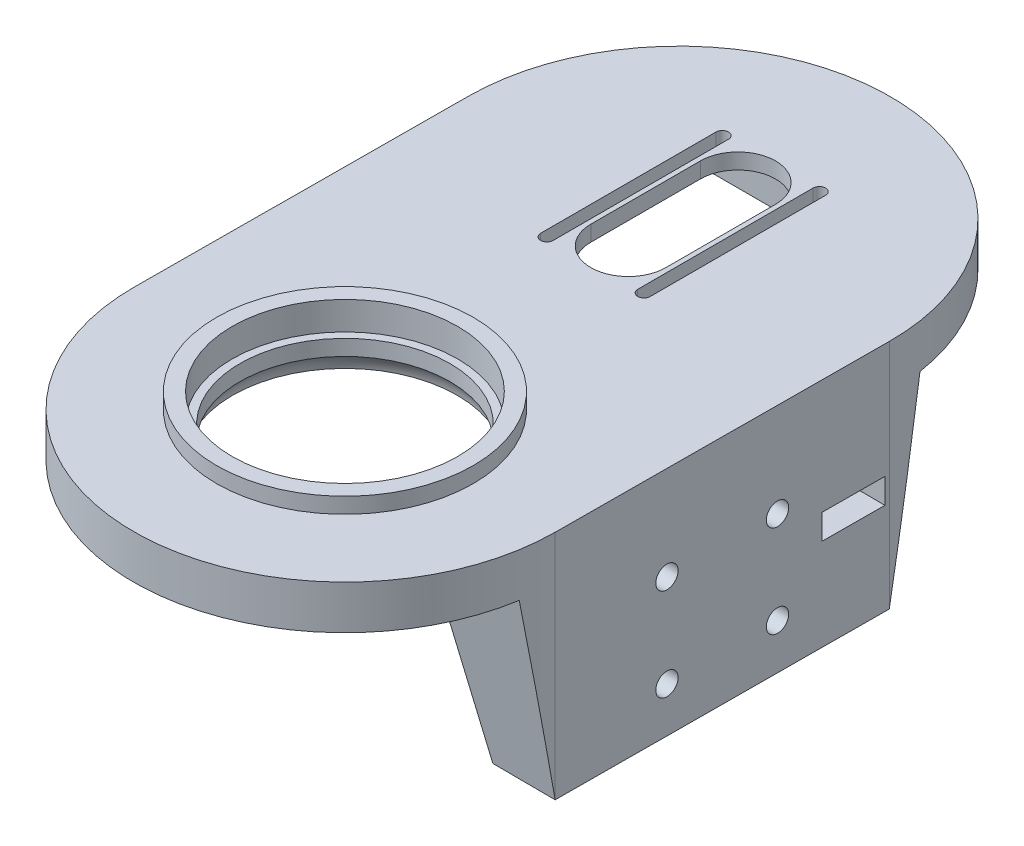
from build123d import *

# Parameters (mm, degrees)
BOSS_EXTRUDE1_DEPTH              = 20
SKETCH8_W                        = 42
SKETCH8_H                        = 60
CUT_EXTRUDE1_DEPTH               = 15
CUT_EXTRUDE2_START               = -5
CUT_EXTRUDE2_DEPTH               = 5
SKETCH10_R                       = 36
CUT_EXTRUDE3_DEPTH               = 157.424129235
SKETCH11_R                       = 41
SKETCH11_R_2                     = 36
BOSS_EXTRUDE4_DEPTH              = 5
SKETCH13_W                       = 106.111938503
SKETCH13_H                       = 55
SKETCH13_R                       = 3
BOSS_EXTRUDE9_DEPTH              = 20
BOSS_EXTRUDE13_START             = -5
SKETCH14_R                       = 36
SKETCH14_R_2                     = 33.5
BOSS_EXTRUDE13_DEPTH             = 5
FILLET1_R                        = 10
CUT_EXTRUDE4_DEPTH               = 6
CBORE_FOR_M6_5_SHSS1_D           = 7.1
CBORE_FOR_M6_5_SHSS1_CBORE_D     = 11
CBORE_FOR_M6_5_SHSS1_CBORE_DEPTH = 4.5
CHAMFER5_SIZE                    = 10.579618843
CHAMFER5_SIZE_2                  = 60
CUT_EXTRUDE5_DEPTH               = 1
SKETCH23_W                       = 20
SKETCH23_H                       = 8
CUT_EXTRUDE6_DEPTH               = 34
FILLET5_R                        = 2


with BuildPart() as part:
    # Sketch1 → Boss-Extrude1 (new body)
    with BuildSketch(Plane(origin=(0, 0, 0), x_dir=(1, 0, 0), z_dir=(0, 1, 0))):
        with BuildLine():
            Line((48.082138056, 60.239377577), (47.498980657, -45.87095849))
            ThreePointArc((47.498980657, -45.87095849), (-20.370958489, -112.998980658), (-87.498980658, -45.129041511))
            Line((-87.498980658, -45.129041511), (-86.915823259, 60.981294555))
            ThreePointArc((-86.915823259, 60.981294555), (-19.045884112, 128.109316723), (48.082138056, 60.239377577))
        make_face()
    extrude(amount=BOSS_EXTRUDE1_DEPTH)

    # Sketch8 → Cut-Extrude1 (cut)
    with BuildSketch(Plane.XZ):
        with Locations((-20, -62.5)):
            Rectangle(SKETCH8_W, SKETCH8_H)
    extrude(amount=-CUT_EXTRUDE1_DEPTH, mode=Mode.SUBTRACT)

    # Cut-Extrude2: read off the stored shape, not the designer's step
    # Cut-Extrude2 outline → Cut-Extrude2 (cut)
    with BuildSketch(Plane.XZ.offset(-15).offset(CUT_EXTRUDE2_START)):
        with BuildLine():
            Line((-6.5, -34.5), (-6.5, -90.5))
            ThreePointArc((-6.5, -90.5), (-4.5, -92.5), (-2.5, -90.5))
            Line((-2.5, -90.5), (-2.5, -34.5))
            ThreePointArc((-2.5, -34.5), (-4.5, -32.5), (-6.5, -34.5))
        make_face()
        with BuildLine():
            ThreePointArc((-8, -45), (-20, -33), (-32, -45))
            Line((-32, -45), (-32, -80))
            ThreePointArc((-32, -80), (-20, -92), (-8, -80))
            Line((-8, -80), (-8, -45))
        make_face()
        with BuildLine():
            Line((-37.5, -34.5), (-37.5, -90.5))
            ThreePointArc((-37.5, -90.5), (-35.5, -92.5), (-33.5, -90.5))
            Line((-33.5, -90.5), (-33.5, -34.5))
            ThreePointArc((-33.5, -34.5), (-35.5, -32.5), (-37.5, -34.5))
        make_face()
    extrude(amount=CUT_EXTRUDE2_DEPTH, mode=Mode.SUBTRACT)

    # Sketch10 → Cut-Extrude3 (cut, through all)
    with BuildSketch(Plane.XZ):
        with Locations(Location((-20, 45.5, 0), (0, 0, 270))):
            Circle(SKETCH10_R)
    extrude(amount=-CUT_EXTRUDE3_DEPTH, mode=Mode.SUBTRACT)

    # Sketch11 → Boss-Extrude4 (add)
    with BuildSketch(Plane(origin=(0, 20, 0), x_dir=(1, 0, 0), z_dir=(0, 1, 0))):
        with Locations(Location((-20, -45.5, 0), (0, 0, 270))):
            Circle(SKETCH11_R)
        with Locations(Location((-20, -45.5, 0), (0, 0, 90))):
            Circle(SKETCH11_R_2, mode=Mode.SUBTRACT)
    extrude(amount=BOSS_EXTRUDE4_DEPTH)

    # Sketch13 → Boss-Extrude9 (add)
    with BuildSketch(Plane(origin=(27.749936459, 0, 0.152507111), x_dir=(-0.00549568132488102, 0, 0.999984898629362), z_dir=(-0.999984898629362, 0, -0.00549568132488102))):
        with Locations((-7.446742736, -27.5)):
            Rectangle(SKETCH13_W, SKETCH13_H)
        with Locations((-25.004242736, -10.014310552)):
            Circle(SKETCH13_R, mode=Mode.SUBTRACT)
        with Locations((10.110757264, -10.014310552)):
            Circle(SKETCH13_R, mode=Mode.SUBTRACT)
        with Locations((10.110757264, -39.577999726)):
            Circle(SKETCH13_R, mode=Mode.SUBTRACT)
        with Locations((-25.004242736, -39.514310552)):
            Circle(SKETCH13_R, mode=Mode.SUBTRACT)
    extrude(amount=-BOSS_EXTRUDE9_DEPTH)

    # Sketch14 → Boss-Extrude13 (add)
    with BuildSketch(Plane(origin=(0, 16, 0), x_dir=(1, 0, 0), z_dir=(0, 1, 0)).offset(BOSS_EXTRUDE13_START)):
        with Locations(Location((-20, -45.5, 0), (0, 0, 90))):
            Circle(SKETCH14_R)
        with Locations(Location((-20, -45.5, 0), (0, 0, 270))):
            Circle(SKETCH14_R_2, mode=Mode.SUBTRACT)
    extrude(amount=BOSS_EXTRUDE13_DEPTH)

    # Fillet1
    # the kernel refuses this fillet: 10 mm, written as the material it adds along each edge
    with BuildSketch(Plane(origin=(-20, 11, 45.5), x_dir=(0, 0, -1), z_dir=(1, 0, 0))) as fillet1_piece_1:
        with BuildLine():
            CenterArc((26, -6.614378278), FILLET1_R, 0, 41.409622109)
            Line((36, -6.614378278), (36.2, -6.614378278))
            Line((36.2, -6.614378278), (36.2, 0))
            Line((36.2, 0), (36, 0.2))
            ThreePointArc((36, 0.2), (34.75, 0.2), (33.65, 0.132287566))
            Line((33.65, 0.132287566), (33.5, 0))
        make_face()
    revolve(axis=Axis((-20, 11, 45.5), (0, 1, 0)))

    # Sketch15 → Cut-Extrude4 (cut)
    with BuildSketch(Plane.XZ):
        with BuildLine():
            Line((27.499282685, 45.761044864), (47.498980657, 45.87095849))
            ThreePointArc((47.498980657, 45.87095849), (-20.370958489, 112.998980658), (-87.498980658, 45.129041511))
            Line((-87.498980658, 45.129041511), (-86.915823259, -60.981294555))
            ThreePointArc((-86.915823259, -60.981294555), (-19.045884112, -128.109316723), (48.082138056, -60.239377577))
            Line((48.082138056, -60.239377577), (28.082440084, -60.349291203))
            Line((28.082440084, -60.349291203), (27.499282685, 45.761044864))
        make_face()
    extrude(amount=-CUT_EXTRUDE4_DEPTH, mode=Mode.SUBTRACT)

    # CBORE for M6.5 SHSS1 (through all)
    with Locations(Plane(origin=(27.749936459, 0, 0.152507111), x_dir=(-0.005495681324881029, 0, 0.999984898629362), z_dir=(-0.999984898629362, 0, -0.005495681324881029))):
        with Locations((10.110757264, -39.577999726), (-25.004242736, -39.514310552), (10.110757264, -10.014310552), (-25.004242736, -10.014310552)):
            CounterBoreHole(CBORE_FOR_M6_5_SHSS1_D / 2, CBORE_FOR_M6_5_SHSS1_CBORE_D / 2, CBORE_FOR_M6_5_SHSS1_CBORE_DEPTH)

    # Chamfer5
    # the kernel refuses this chamfer: 60, 10.579618843 mm, written as the material it adds along each edge
    with BuildSketch(Plane(origin=(28.939284552, 6, -216.259264498), x_dir=(-0.9999848986293619, 0, -0.00549568132488103), z_dir=(-0.00549568132488103, 0, 0.999984898629362))) as chamfer5_piece_1_section:
        Polygon((CHAMFER5_SIZE, 0), (0, CHAMFER5_SIZE_2), (0, 0), align=None)
    chamfer5_piece_1 = extrude(amount=417.936594073, mode=Mode.PRIVATE)
    chamfer5_piece_1 = chamfer5_piece_1 - Plane(origin=(27.887351809, -10.014310552, -24.851358027), x_dir=(-0.005495681324881029, 0, 0.999984898629362), z_dir=(-0.999984898629362, 0, -0.005495681324881029)) * Cylinder(5.5, 1076, mode=Mode.PRIVATE)
    chamfer5_piece_1 = chamfer5_piece_1 - Plane(origin=(27.694370959, -10.014310552, 10.263111688), x_dir=(-0.005495681324881029, 0, 0.999984898629362), z_dir=(-0.999984898629362, 0, -0.005495681324881029)) * Cylinder(5.5, 1076, mode=Mode.PRIVATE)
    chamfer5_piece_1 = chamfer5_piece_1 - Plane(origin=(27.887351809, -39.514310552, -24.851358027), x_dir=(-0.005495681324881029, 0, 0.999984898629362), z_dir=(-0.999984898629362, 0, -0.005495681324881029)) * Cylinder(5.5, 1076, mode=Mode.PRIVATE)
    chamfer5_piece_1 = chamfer5_piece_1 - Plane(origin=(27.694370959, -39.577999726, 10.263111688), x_dir=(-0.005495681324881029, 0, 0.999984898629362), z_dir=(-0.999984898629362, 0, -0.005495681324881029)) * Cylinder(5.5, 1076, mode=Mode.PRIVATE)
    chamfer5_piece_1 = split(chamfer5_piece_1, bisect_by=Plane(origin=(27.486315043, -40.618009932, 48.120615135), z_dir=(0.0054121895768273285, 0.17364817766693125, -0.9847928810653225)), keep=Keep.TOP, mode=Mode.PRIVATE)
    chamfer5_piece_1 = split(chamfer5_piece_1, bisect_by=Plane(origin=(28.164666117, 30.853356971, -75.311001495), z_dir=(-0.00541218957682626, 0.17364817766693136, 0.9847928810653225)), keep=Keep.TOP, mode=Mode.PRIVATE)
    add(chamfer5_piece_1)
    with BuildSketch(Plane(origin=(203.992111352, 6, -59.382533108), x_dir=(0.005495681324880034, 0, -0.9999848986293619), z_dir=(-0.999984898629362, 0, -0.005495681324880034))) as chamfer5_piece_2_section:
        Polygon((CHAMFER5_SIZE, 0), (0, CHAMFER5_SIZE_2), (0, 0), align=None)
    chamfer5_piece_2 = extrude(amount=331.824655571, mode=Mode.PRIVATE)
    chamfer5_piece_2 = chamfer5_piece_2 & Plane(origin=(-19.416842601, 6, -60.610336066), x_dir=(-0.999984898629362, 0, -0.005495681324881549), z_dir=(0, -1, 0)) * Cylinder(67.5, 904, mode=Mode.PRIVATE)
    chamfer5_piece_2 = split(chamfer5_piece_2, bisect_by=Plane(origin=(23.126316359, -25.892001157, -60.376528891), z_dir=(0.9847928810653225, 0.1736481776669314, 0.005412189576827241)), keep=Keep.TOP, mode=Mode.PRIVATE)
    add(chamfer5_piece_2)
    with BuildSketch(Plane(origin=(-128.410690611, 6, 44.904200396), x_dir=(-0.005495681324881117, 0, 0.9999848986293619), z_dir=(0.999984898629362, 0, 0.005495681324881118))) as chamfer5_piece_3_section:
        Polygon((CHAMFER5_SIZE, 0), (0, CHAMFER5_SIZE_2), (0, 0), align=None)
    chamfer5_piece_3 = extrude(amount=331.824655571, mode=Mode.PRIVATE)
    chamfer5_piece_3 = chamfer5_piece_3 & Plane(origin=(-20, 6, 45.500000001), x_dir=(0.999984898629362, 0, 0.0054956813248813385), z_dir=(0, -1, 0)) * Cylinder(67.5, 904, mode=Mode.PRIVATE)
    chamfer5_piece_3 = split(chamfer5_piece_3, bisect_by=Plane(origin=(12.537572393, 30.853356971, 45.67881883), z_dir=(0.9847928810653225, 0.1736481776669314, 0.005412189576827241)), keep=Keep.TOP, mode=Mode.PRIVATE)
    add(chamfer5_piece_3)

    # Sketch22 → Cut-Extrude5 (cut)
    with BuildSketch(Plane.XZ.offset(55)):
        Polygon((27.499282685, 45.761044864), (28.082440084, -60.349291203), (48.082138056, -60.239377577), (47.498980657, 45.87095849), align=None)
    extrude(amount=-CUT_EXTRUDE5_DEPTH, mode=Mode.SUBTRACT)

    # Sketch23 → Cut-Extrude6 (cut)
    with BuildSketch(Plane(origin=(47.749634432, 0, 0.262420737), x_dir=(0.005495681324880889, 0, -0.999984898629362), z_dir=(0.999984898629362, 0, 0.005495681324880889))):
        with Locations((49.130161201, -20.643803513)):
            Rectangle(SKETCH23_W, SKETCH23_H)
    extrude(amount=-CUT_EXTRUDE6_DEPTH, mode=Mode.SUBTRACT)

    # Fillet5
    fillet5_edges = [part.edges().sort_by_distance(p)[0] for p in [
        (21.433134302, -16.643803513, -49.01311169),
        (22.083474761, -20.643803513, -39.009386557),
        (22.843728846, -24.643803513, -49.005359395),
        (22.193388387, -20.643803513, -59.009084529),
    ]]
    fillet(fillet5_edges, radius=FILLET5_R)


solid = part.part
